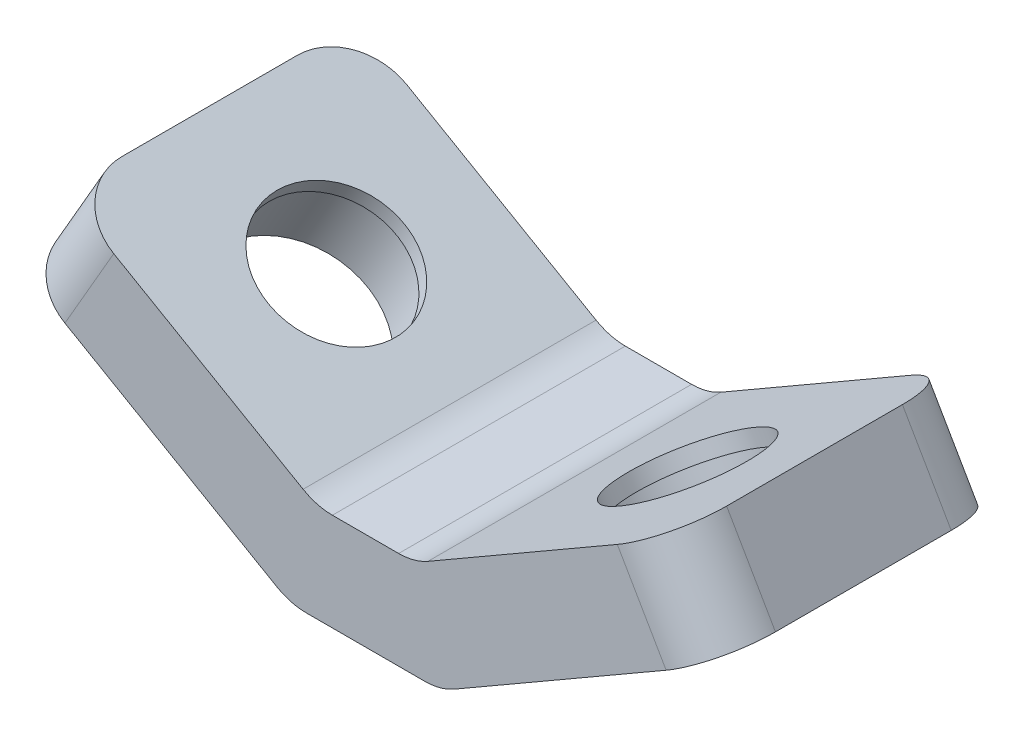
from build123d import *

# Parameters (mm, degrees)
EXTRUDE_1_DEPTH          = 7.5
CUT_EXTRUDE_1_DEPTH      = 27.249846584
CUT_EXTRUDE_1_DEPTH_BACK = 27.249846584
SKETCH_2_R               = 4.1
CUT_EXTRUDE_2_DEPTH      = 27.516200545
CUT_EXTRUDE_2_DEPTH_BACK = 27.516200545
SKETCH_3_R               = 4.1
FILLET_1_R               = 3
EXTRUDE_START            = -0.8
SKETCH_4_R               = 4.1
SKETCH_4_R_2             = 3.5
EXTRUDE_2_DEPTH          = 0.8
SKETCH_5_R               = 4.1
SKETCH_5_R_2             = 3.5
EXTRUDE_3_DEPTH          = 0.8


with BuildPart() as part:
    # ｽｹｯﾁ1 → ﾎﾞｽ - 押し出し1 (new, symmetric)
    with BuildSketch(Plane.XY):
        Polygon((0, 0), (-14.150635095, 8.169872981), (-11.650635095, 12.5), (1.339745962, 5), (6.339745962, 5), (19.330127019, 12.5), (21.830127019, 8.169872981), (7.679491924, 0), align=None)
    extrude(amount=EXTRUDE_1_DEPTH, both=True)

    # ｽｹｯﾁ2 → ｶｯﾄ - 押し出し1 (cut, two sides: drawn at the far end of the back side and taken through both)
    with BuildSketch(Plane(origin=(0, 0, 0), x_dir=(0, 0, 1), z_dir=(-0.5000000000000012, -0.866025403784438, 0)).offset(-CUT_EXTRUDE_1_DEPTH_BACK)):
        with Locations((0, 8.839745962)):
            Circle(SKETCH_2_R)
    extrude(amount=CUT_EXTRUDE_1_DEPTH + CUT_EXTRUDE_1_DEPTH_BACK, mode=Mode.SUBTRACT)

    # ｽｹｯﾁ3 → ｶｯﾄ - 押し出し2 (cut, two sides: drawn at the far end of the back side and taken through both)
    with BuildSketch(Plane(origin=(1.919872981, -3.325317547, 0), x_dir=(0, 0, -1), z_dir=(0.5000000000000013, -0.8660254037844379, 0)).offset(-CUT_EXTRUDE_2_DEPTH_BACK)):
        with Locations((0, 15.490381057)):
            Circle(SKETCH_3_R)
    extrude(amount=CUT_EXTRUDE_2_DEPTH + CUT_EXTRUDE_2_DEPTH_BACK, mode=Mode.SUBTRACT)

    # ﾌｨﾚｯﾄ1
    fillet_1_edges = [part.edges().sort_by_distance(p)[0] for p in [
        (20.580127019, 10.334936491, -7.5),
        (20.580127019, 10.334936491, 7.5),
        (-12.900635095, 10.334936491, -7.5),
        (-12.900635095, 10.334936491, 7.5),
        (7.679491924, 0, 0),
        (0, 0, 0),
        (6.339745962, 5, 0),
        (1.339745962, 5, 0),
    ]]
    fillet(fillet_1_edges, radius=FILLET_1_R)

    # ｽｹｯﾁ4 → ﾎﾞｽ - 押し出し2 (add)
    with BuildSketch(Plane(origin=(2.5, 4.330127019, 0), x_dir=(0.8660254037844382, -0.500000000000001, 0), z_dir=(0.5000000000000009, 0.866025403784438, 0)).offset(EXTRUDE_START)):
        with Locations((-8.839745962, 0)):
            Circle(SKETCH_4_R)
        with Locations((-8.839745962, 0)):
            Circle(SKETCH_4_R_2, mode=Mode.SUBTRACT)
    extrude(amount=EXTRUDE_2_DEPTH)

    # ｽｹｯﾁ5 → ﾎﾞｽ - 押し出し3 (add)
    with BuildSketch(Plane(origin=(-0.580127019, 1.004809472, 0), x_dir=(0.8660254037844376, 0.500000000000002, 0), z_dir=(-0.500000000000002, 0.8660254037844376, 0)).offset(EXTRUDE_START)):
        with Locations((15.490381057, 0)):
            Circle(SKETCH_5_R)
        with Locations((15.490381057, 0)):
            Circle(SKETCH_5_R_2, mode=Mode.SUBTRACT)
    extrude(amount=EXTRUDE_3_DEPTH)


solid = part.part
